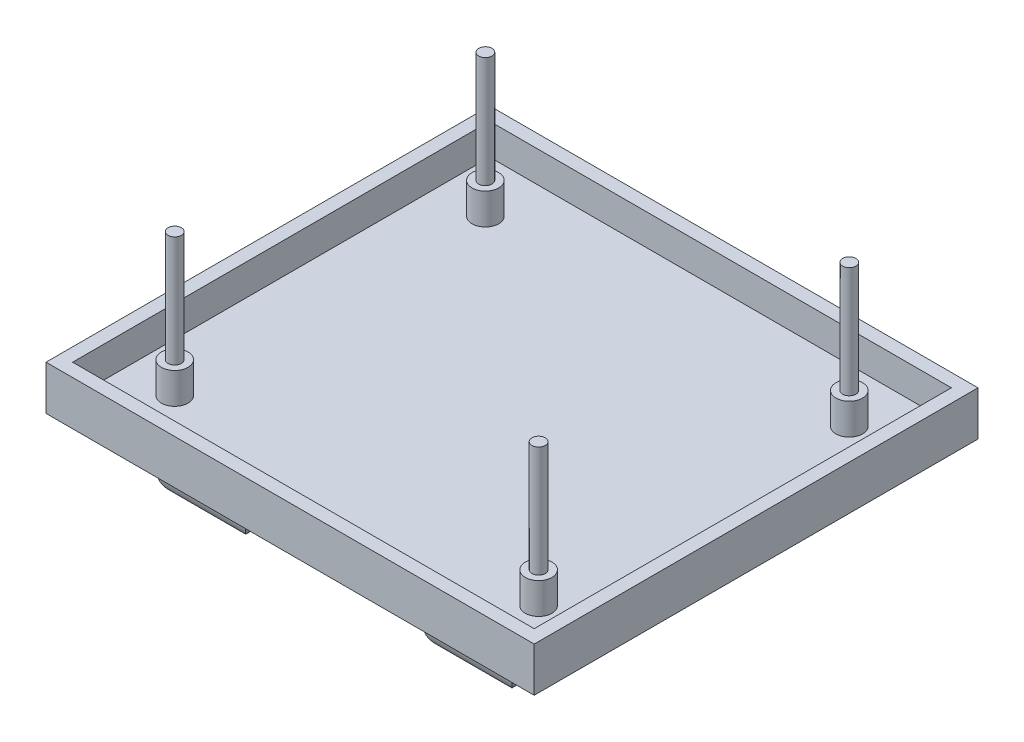
from build123d import *

# Parameters (mm, degrees)
SKETCH1_W           = 110
SKETCH1_H           = 100
BOSS_EXTRUDE1_DEPTH = 3
SKETCH2_W           = 110
SKETCH2_H           = 100
SKETCH2_W_2         = 104
SKETCH2_H_2         = 94
SKETCH2_R           = 3
BOSS_EXTRUDE2_DEPTH = 7
SKETCH3_R           = 1.5
BOSS_EXTRUDE3_DEPTH = 25
SKETCH5_W           = 20
SKETCH5_H           = 8
BOSS_EXTRUDE4_DEPTH = 10
SKETCH6_W           = 20
SKETCH6_H           = 80
BOSS_EXTRUDE5_DEPTH = 4
FILLET1_R           = 5


with BuildPart() as part:
    # Sketch1 → Boss-Extrude1 (new body)
    with BuildSketch(Plane(origin=(0, 0, 0), x_dir=(1, 0, 0), z_dir=(0, 1, 0))):
        Rectangle(SKETCH1_W, SKETCH1_H)
    extrude(amount=BOSS_EXTRUDE1_DEPTH)

    # Sketch2 → Boss-Extrude2 (add)
    # profile 1 of 5: a face of its own
    with BuildSketch(Plane(origin=(0, 3, 0), x_dir=(1, 0, 0), z_dir=(0, 1, 0))):
        Rectangle(SKETCH2_W, SKETCH2_H)
        Rectangle(SKETCH2_W_2, SKETCH2_H_2, mode=Mode.SUBTRACT)
    # profile 2 of 5: a face of its own
    with BuildSketch(Plane(origin=(0, 3, 0), x_dir=(1, 0, 0), z_dir=(0, 1, 0))):
        with Locations(Location((-41, 35, 0), (0, 0, 270))):
            Circle(SKETCH2_R)
    # profile 3 of 5: a face of its own
    with BuildSketch(Plane(origin=(0, 3, 0), x_dir=(1, 0, 0), z_dir=(0, 1, 0))):
        with Locations(Location((-41, -35, 0), (0, 0, 270))):
            Circle(SKETCH2_R)
    # profile 4 of 5: a face of its own
    with BuildSketch(Plane(origin=(0, 3, 0), x_dir=(1, 0, 0), z_dir=(0, 1, 0))):
        with Locations(Location((41, 35, 0), (0, 0, 270))):
            Circle(SKETCH2_R)
    # profile 5 of 5: a face of its own
    with BuildSketch(Plane(origin=(0, 3, 0), x_dir=(1, 0, 0), z_dir=(0, 1, 0))):
        with Locations(Location((41, -35, 0), (0, 0, 90))):
            Circle(SKETCH2_R)
    extrude(amount=BOSS_EXTRUDE2_DEPTH)

    # Sketch3 → Boss-Extrude3 (add)
    with BuildSketch(Plane(origin=(0, 10, 0), x_dir=(1, 0, 0), z_dir=(0, 1, 0))):
        with Locations(Location((-41, 35, 0), (0, 0, 270))):
            Circle(SKETCH3_R)
        with Locations(Location((41, 35, 0), (0, 0, 270))):
            Circle(SKETCH3_R)
        with Locations(Location((41, -35, 0), (0, 0, 270))):
            Circle(SKETCH3_R)
        with Locations(Location((-41, -35, 0), (0, 0, 270))):
            Circle(SKETCH3_R)
    extrude(amount=BOSS_EXTRUDE3_DEPTH)

    # Sketch5 → Boss-Extrude4 (add)
    with BuildSketch(Plane.XZ):
        with Locations((-30, -36)):
            Rectangle(SKETCH5_W, SKETCH5_H)
        with Locations((-30, 36)):
            Rectangle(SKETCH5_W, SKETCH5_H)
        with Locations((30, 36)):
            Rectangle(SKETCH5_W, SKETCH5_H)
        with Locations((30, -36)):
            Rectangle(SKETCH5_W, SKETCH5_H)
    extrude(amount=BOSS_EXTRUDE4_DEPTH)

    # Sketch6 → Boss-Extrude5 (add)
    with BuildSketch(Plane.XZ.offset(10)):
        with Locations((-30, 0)):
            Rectangle(SKETCH6_W, SKETCH6_H)
        with Locations((30, 0)):
            Rectangle(SKETCH6_W, SKETCH6_H)
    extrude(amount=BOSS_EXTRUDE5_DEPTH)

    # Fillet1
    # the kernel refuses this fillet: 5 mm, written as the material it takes off along each edge
    with BuildSketch(Plane(origin=(-40, -14, -52.5), x_dir=(1, 0, 0), z_dir=(0, 0, 1)), Plane(origin=(-20, -14, 52.5), x_dir=(-1, 0, 0), z_dir=(0, 0, -1)), Plane(origin=(20, -14, -52.5), x_dir=(1, 0, 0), z_dir=(0, 0, 1)), Plane(origin=(40, -14, 52.5), x_dir=(-1, 0, 0), z_dir=(0, 0, -1))) as fillet1_piece_1:
        with BuildLine():
            CenterArc((FILLET1_R, FILLET1_R), FILLET1_R, 180, 90)
            Line((0, FILLET1_R), (0, 0))
            Line((0, 0), (FILLET1_R, 0))
        make_face()
    extrude(amount=105, mode=Mode.SUBTRACT)
    with BuildSketch(Plane(origin=(7.5, -14, 40), x_dir=(0, 0, -1), z_dir=(1, 0, 0)), Plane(origin=(-52.5, -14, 40), x_dir=(0, 0, -1), z_dir=(1, 0, 0))) as fillet1_piece_2:
        with BuildLine():
            CenterArc((FILLET1_R, FILLET1_R), FILLET1_R, 180, 90)
            Line((0, FILLET1_R), (0, 0))
            Line((0, 0), (FILLET1_R, 0))
        make_face()
    extrude(amount=45, mode=Mode.SUBTRACT)
    with BuildSketch(Plane(origin=(52.5, -14, -40), x_dir=(0, 1, 0), z_dir=(-1, 0, 0)), Plane(origin=(-7.5, -14, -40), x_dir=(0, 1, 0), z_dir=(-1, 0, 0))) as fillet1_piece_3:
        with BuildLine():
            CenterArc((FILLET1_R, -FILLET1_R), FILLET1_R, 90, 90)
            Line((0, -FILLET1_R), (0, 0))
            Line((0, 0), (FILLET1_R, 0))
        make_face()
    extrude(amount=45, mode=Mode.SUBTRACT)


solid = part.part
